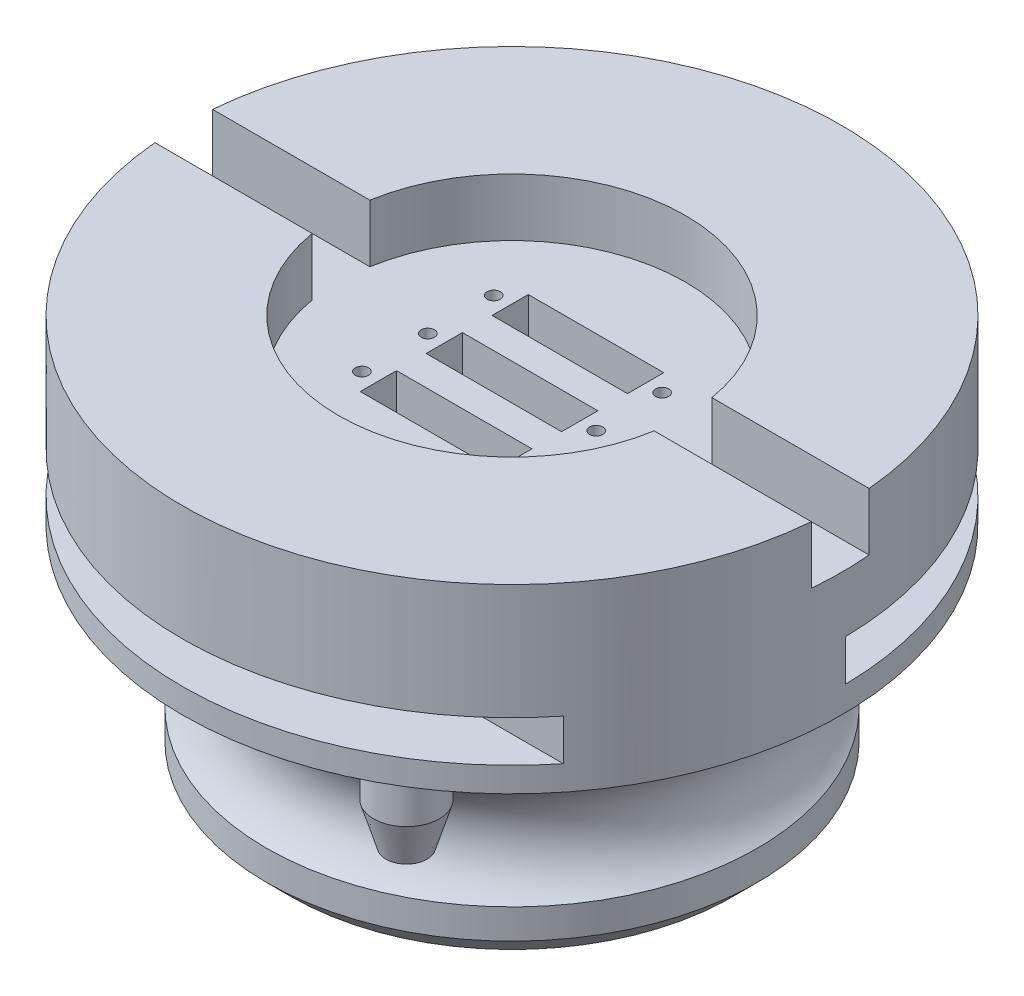
from build123d import *

# Parameters (mm, degrees)
SKETCH1_R                            = 29.8
SKETCH1_R_2                          = 20.2
BOSS_EXTRUDE1_DEPTH                  = 25.7
SKETCH3_R                            = 40
BOSS_EXTRUDE2_DEPTH                  = 15
SKETCH4_R                            = 4
BOSS_EXTRUDE3_DEPTH                  = 5
SKETCH6_R                            = 2.5
CUT_EXTRUDE1_START                   = -12
CUT_EXTRUDE1_DEPTH                   = 5
CUT_EXTRUDE6_DEPTH                   = 3.2
SKETCH15_W                           = 16.44
SKETCH15_H                           = 4.4
CUT_EXTRUDE7_DEPTH                   = 63.132841557
SKETCH16_R                           = 0.8
CUT_EXTRUDE8_DEPTH                   = 64.523302811
CUT_EXTRUDE15_START                  = 40
SKETCH25_R                           = 3.2
CUT_EXTRUDE15_DEPTH                  = 3.5
SKETCH20_R                           = 40
SKETCH20_R_2                         = 21.05
BOSS_EXTRUDE4_DEPTH                  = 7
CUT_EXTRUDE17_REACH                  = 75.995
CUT_EXTRUDE17_END_RADIUS             = 40
SKETCH28_W                           = 7
SKETCH28_H                           = 7
CUT_EXTRUDE17_DIRECTION_2_REACH      = 75.995
CUT_EXTRUDE17_DIRECTION_2_END_RADIUS = 40


with BuildPart() as part:
    # Sketch1 → Boss-Extrude1 (new body)
    with BuildSketch(Plane(origin=(0, 0, 0), x_dir=(1, 0, 0), z_dir=(0, 1, 0))):
        with Locations(Location((0, 0, 0), (0, 0, 90))):
            Circle(SKETCH1_R)
        with Locations(Location((0, 0, 0), (0, 0, 90))):
            Circle(SKETCH1_R_2, mode=Mode.SUBTRACT)
    extrude(amount=BOSS_EXTRUDE1_DEPTH)

    # Sketch2 → Cut-Revolve1 (revolve, cut)
    with BuildSketch(Plane.XY, mode=Mode.PRIVATE) as cut_revolve1_sk:
        with BuildLine():
            Line((29.8, 12.7), (29.8, 18.799180273))
            ThreePointArc((29.8, 18.799180273), (27.590586132, 16.098529094), (26.8, 12.7))
            Line((26.8, 12.7), (29.8, 12.7))
        make_face()
        with BuildLine():
            Line((29.8, 6.600819727), (29.8, 12.7))
            Line((29.8, 12.7), (26.8, 12.7))
            ThreePointArc((26.8, 12.7), (27.590586132, 9.301470906), (29.8, 6.600819727))
        make_face()
        Polygon((29.8, 3), (26.8, 0), (29.8, 0), align=None)
    revolve(cut_revolve1_sk.sketch.rotate(Axis((0, 25.7, 0), (0, -1, 0)), 270), axis=Axis((0, 25.7, 0), (0, -1, 0)), mode=Mode.SUBTRACT)

    # Sketch3 → Boss-Extrude2 (add)
    with BuildSketch(Plane(origin=(0, 25.7, 0), x_dir=(1, 0, 0), z_dir=(0, 1, 0))):
        with Locations(Location((0, 0, 0), (0, 0, 270))):
            Circle(SKETCH3_R)
    extrude(amount=BOSS_EXTRUDE2_DEPTH)

    # Sketch4 → Boss-Extrude3 (add)
    with BuildSketch(Plane(origin=(0, 25.7, 0), x_dir=(-1, 0, 0), z_dir=(0, -1, 0))):
        with Locations(Location((-17.5, -30.310889132, 0), (0, 0, 270))):
            Circle(SKETCH4_R)
        with Locations(Location((32.889241728, -11.970705016, 0), (0, 0, 270))):
            Circle(SKETCH4_R)
        with Locations(Location((-6.077686218, 34.468271355, 0), (0, 0, 270))):
            Circle(SKETCH4_R)
    extrude(amount=BOSS_EXTRUDE3_DEPTH)

    # Sketch6 → section 1 of loft1
    with BuildSketch(Plane(origin=(0, 15.7, 0), x_dir=(-1, 0, 0), z_dir=(0, -1, 0)), mode=Mode.PRIVATE) as loft1_s1:
        with Locations((32.889241728, -11.970705016)):
            Circle(SKETCH6_R)
    # loft from a face of the part (loft1)
    loft([part.faces().sort_by_distance((-32.889241728, 20.7, 11.970705016))[0], loft1_s1.sketch])

    # Boundary1: read off the stored shape, not the designer's step
    # Boundary1 outline → Boundary1 (revolve)
    with BuildSketch(Plane(origin=(17.5, 0, 30.310889132), x_dir=(1, 0, 0), z_dir=(0, 0, 1))):
        Polygon((0, 20.7), (0, 15.7), (2.5, 15.7), (4, 20.7), align=None)
    revolve(axis=Axis((17.5, 0, 30.310889132), (0, 1, 0)))

    # Boundary2: read off the stored shape, not the designer's step
    # Boundary2: loft between two sections, ruled curve by curve
    boundary2_from = [
        Edge.make_bspline([(9.922742778, 20.7, -33.365756026), (9.778423859, 20.7, -32.862439299), (9.289775651, 20.7, -31.913155977), (8.067478825, 20.7, -30.878607721), (6.542374051, 20.7, -30.390384874), (4.946413374, 20.7, -30.522974824), (3.522746317, 20.7, -31.256212676), (2.488002725, 20.7, -32.478460941), (1.999820352, 20.7, -34.003603594), (2.132382571, 20.7, -35.599531113), (2.865650923, 20.7, -37.023214684), (4.087837179, 20.7, -38.057933438), (5.613033755, 20.7, -38.546155237), (7.208931106, 20.7, -38.413575903), (8.632657493, 20.7, -37.680313497), (9.667322676, 20.7, -36.45811299), (10.155689167, 20.7, -34.933056337), (10.067061697, 20.7, -33.869072752), (9.922742778, 20.7, -33.365756026)], [0, 0, 0, 0, 0.0625, 0.125, 0.1875, 0.25, 0.3125, 0.375, 0.4375, 0.5, 0.5625, 0.625, 0.6875, 0.75, 0.8125, 0.875, 0.9375, 1, 1, 1, 1], 3),
    ]
    boundary2_to = [
        Edge.make_bspline([(8.313438837, 15.7, -33.349606871), (8.167005998, 15.7, -33.056947538), (7.757868808, 15.7, -32.529805617), (6.88811309, 15.7, -32.034506513), (5.895137902, 15.7, -31.909602819), (4.929849468, 15.7, -32.174234081), (4.139348951, 15.7, -32.788112293), (3.643935799, 15.7, -33.657748526), (3.519005287, 15.7, -34.650828768), (3.783658552, 15.7, -35.616093907), (4.397524642, 15.7, -36.406629525), (5.26722668, 15.7, -36.902042852), (6.260254151, 15.7, -37.026934051), (7.225507947, 15.7, -36.762316146), (8.016039922, 15.7, -36.14841822), (8.511411727, 15.7, -35.27881634), (8.63646584, 15.7, -34.285761617), (8.459871676, 15.7, -33.642266205), (8.313438837, 15.7, -33.349606871)], [0, 0, 0, 0, 0.0625, 0.125, 0.1875, 0.25, 0.3125, 0.375, 0.4375, 0.5, 0.5625, 0.625, 0.6875, 0.75, 0.8125, 0.875, 0.9375, 1, 1, 1, 1], 3),
    ]
    boundary2 = Solid(Shell([*[Face.make_surface_from_curves(boundary2_from[k], boundary2_to[k]) for k in range(1)], Face(Wire(boundary2_from)), Face(Wire(boundary2_to))]))
    add(boundary2)

    # Sketch7 → Cut-Extrude1 (cut)
    with BuildSketch(Plane(origin=(0, 40.7, 0), x_dir=(1, 0, 0), z_dir=(0, 1, 0)).offset(CUT_EXTRUDE1_START)):
        with BuildLine():
            ThreePointArc((31.224989992, 25), (0, 40), (-31.224989992, 25))
            Line((-31.224989992, 25), (0, 25))
            Line((0, 25), (31.224989992, 25))
        make_face()
        with BuildLine():
            Line((-5.8e-08, -25), (-31.224989992, -25))
            ThreePointArc((-31.224989992, -25), (0, -40), (31.224989992, -25))
            Line((31.224989992, -25), (-5.8e-08, -25))
        make_face()
        with BuildLine():
            Line((-19.515618745, -15.625), (-31.224989992, -25))
            Line((-31.224989992, -25), (-5.8e-08, -25))
            ThreePointArc((-5.8e-08, -25), (-10.825317574, -22.534695459), (-19.515618745, -15.625))
        make_face()
        with BuildLine():
            Line((-24.998227986, -0.297653397), (-39.997164778, -0.476245435))
            ThreePointArc((-39.997164778, -0.476245435), (-37.663011922, -13.472102025), (-31.224989992, -25))
            Line((-31.224989992, -25), (-19.515618745, -15.625))
            ThreePointArc((-19.515618745, -15.625), (-23.539382451, -8.420063766), (-24.998227986, -0.297653397))
        make_face()
        with BuildLine():
            ThreePointArc((39.997164778, 0.476245435), (37.663011922, 13.472102025), (31.224989992, 25))
            Line((31.224989992, 25), (19.515618745, 15.625))
            ThreePointArc((19.515618745, 15.625), (23.539382451, 8.420063766), (24.998227986, 0.297653397))
            Line((24.998227986, 0.297653397), (39.997164778, 0.476245435))
        make_face()
        with BuildLine():
            Line((31.224989992, 25), (0, 25))
            ThreePointArc((0, 25), (10.825317547, 22.534695472), (19.515618745, 15.625))
            Line((19.515618745, 15.625), (31.224989992, 25))
        make_face()
    extrude(amount=CUT_EXTRUDE1_DEPTH, mode=Mode.SUBTRACT)

    # Sketch14 → Cut-Extrude6 (cut)
    with BuildSketch(Plane(origin=(0, 25.7, 0), x_dir=(-1, 0, 0), z_dir=(0, -1, 0))):
        with BuildLine():
            Line((10.22, -2.2), (-10.22, -2.2))
            ThreePointArc((-10.22, -2.2), (-12.42, 0), (-10.22, 2.2))
            Line((-10.22, 2.2), (10.22, 2.2))
            ThreePointArc((10.22, 2.2), (12.42, 0), (10.22, -2.2))
        make_face()
        with BuildLine():
            Line((10.22, 10.2), (-10.22, 10.2))
            ThreePointArc((-10.22, 10.2), (-12.42, 8), (-10.22, 5.8))
            Line((-10.22, 5.8), (10.22, 5.8))
            ThreePointArc((10.22, 5.8), (12.42, 8), (10.22, 10.2))
        make_face()
        with BuildLine():
            Line((10.22, -5.8), (-10.22, -5.8))
            ThreePointArc((-10.22, -5.8), (-12.42, -8), (-10.22, -10.2))
            Line((-10.22, -10.2), (10.22, -10.2))
            ThreePointArc((10.22, -10.2), (12.42, -8), (10.22, -5.8))
        make_face()
    extrude(amount=-CUT_EXTRUDE6_DEPTH, mode=Mode.SUBTRACT)

    # Sketch15 → Cut-Extrude7 (cut, through all)
    with BuildSketch(Plane(origin=(0, 25.7, 0), x_dir=(-1, 0, 0), z_dir=(0, -1, 0))):
        Rectangle(SKETCH15_W, SKETCH15_H)
        with Locations((0, -8)):
            Rectangle(SKETCH15_W, SKETCH15_H)
        with Locations((0, 8)):
            Rectangle(SKETCH15_W, SKETCH15_H)
    extrude(amount=-CUT_EXTRUDE7_DEPTH, mode=Mode.SUBTRACT)

    # Sketch16 → Cut-Extrude8 (cut, through all)
    with BuildSketch(Plane(origin=(0, 28.9, 0), x_dir=(-1, 0, 0), z_dir=(0, -1, 0))):
        with Locations(Location((-10.22, -8, 0), (0, 0, 90))):
            Circle(SKETCH16_R)
        with Locations(Location((-10.22, 0, 0), (0, 0, 90))):
            Circle(SKETCH16_R)
        with Locations(Location((-10.22, 8, 0), (0, 0, 90))):
            Circle(SKETCH16_R)
        with Locations(Location((10.22, -8, 0), (0, 0, 90))):
            Circle(SKETCH16_R)
        with Locations(Location((10.22, 0, 0), (0, 0, 90))):
            Circle(SKETCH16_R)
        with Locations(Location((10.22, 8, 0), (0, 0, 90))):
            Circle(SKETCH16_R)
    extrude(amount=-CUT_EXTRUDE8_DEPTH, mode=Mode.SUBTRACT)

    # Sketch25 → Cut-Extrude15 (cut)
    with BuildSketch(Plane(origin=(0, 0, 0), x_dir=(0, -1, 0), z_dir=(-0.9455185755993166, 0, -0.32556815445715737)).offset(CUT_EXTRUDE15_START)):
        with Locations(Location((-31.2, 0, 0), (0, 0, 90))):
            Circle(SKETCH25_R)
    extrude(amount=-CUT_EXTRUDE15_DEPTH, mode=Mode.SUBTRACT)

    # Sketch20 → Boss-Extrude4 (add)
    with BuildSketch(Plane(origin=(0, 40.7, 0), x_dir=(1, 0, 0), z_dir=(0, 1, 0))):
        with Locations(Location((0, 0, 0), (0, 0, 270))):
            Circle(SKETCH20_R)
        with Locations(Location((0, 0, 0), (0, 0, 270))):
            Circle(SKETCH20_R_2, mode=Mode.SUBTRACT)
    extrude(amount=BOSS_EXTRUDE4_DEPTH)

    # Cut-Extrude17: up to this cylinder (the profile starts inside it)
    cut_extrude17_end = Plane(origin=(0, 44.2, 0), z_dir=(0, -1, 0)) * Cylinder(CUT_EXTRUDE17_END_RADIUS, 232.99, mode=Mode.PRIVATE)
    # Sketch28 → Cut-Extrude17 (cut, up to the surface)
    with BuildSketch(Plane(origin=(0, 0, 0), x_dir=(0, 0, -1), z_dir=(1, 0, 0)), mode=Mode.PRIVATE) as cut_extrude17_sk1:
        with Locations((0, 44.2)):
            Rectangle(SKETCH28_W, SKETCH28_H)
    cut_extrude17_tool1 = extrude(cut_extrude17_sk1.sketch, amount=-CUT_EXTRUDE17_REACH, mode=Mode.PRIVATE) & cut_extrude17_end
    add(cut_extrude17_tool1.solids().sort_by_distance((0, 44.2, 0))[0], mode=Mode.SUBTRACT)

    # Cut-Extrude17 direction 2: up to this cylinder (the profile starts inside it)
    cut_extrude17_direction_2_end = Plane(origin=(0, 44.2, 0), z_dir=(0, -1, 0)) * Cylinder(CUT_EXTRUDE17_DIRECTION_2_END_RADIUS, 232.99, mode=Mode.PRIVATE)
    # Sketch28 → Cut-Extrude17 direction 2 (cut, up to the surface)
    with BuildSketch(Plane(origin=(0, 0, 0), x_dir=(0, 0, -1), z_dir=(1, 0, 0)), mode=Mode.PRIVATE) as cut_extrude17_direction_2_sk1:
        with Locations((0, 44.2)):
            Rectangle(SKETCH28_W, SKETCH28_H)
    cut_extrude17_direction_2_tool1 = extrude(cut_extrude17_direction_2_sk1.sketch, amount=CUT_EXTRUDE17_DIRECTION_2_REACH, mode=Mode.PRIVATE) & cut_extrude17_direction_2_end
    add(cut_extrude17_direction_2_tool1.solids().sort_by_distance((0, 44.2, 0))[0], mode=Mode.SUBTRACT)


solid = part.part
